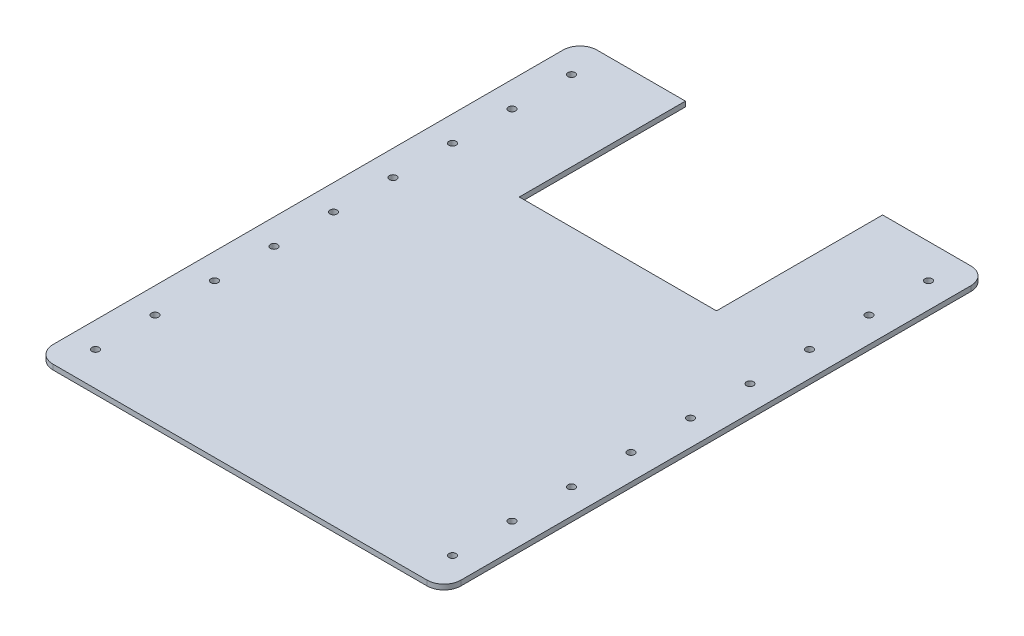
from build123d import *

# Parameters (mm, degrees)
SKETCH_1_W          = 240
SKETCH_1_H          = 320
EXTRUDE_1_DEPTH     = 3
FILLET_1_R          = 10
SKETCH_2_R          = 2.1
CUT_EXTRUDE_1_DEPTH = 3
SKETCH_3_W          = 115.999744718
SKETCH_3_H          = 97.711404684
CUT_EXTRUDE_2_DEPTH = 10


with BuildPart() as part:
    # 草图1 → 凸台-拉伸1 (new body)
    with BuildSketch(Plane(origin=(0, 0, 0), x_dir=(1, 0, 0), z_dir=(0, 1, 0))):
        Rectangle(SKETCH_1_W, SKETCH_1_H)
    extrude(amount=EXTRUDE_1_DEPTH)

    # 圆角1
    fillet_1_edges = [part.edges().sort_by_distance(p)[0] for p in [
        (-120, 1.5, -160),
        (120, 1.5, -160),
        (120, 1.5, 160),
        (-120, 1.5, 160),
    ]]
    fillet(fillet_1_edges, radius=FILLET_1_R)

    # 草图2 → 切除-拉伸1 (cut)
    with BuildSketch(Plane(origin=(0, 3, 0), x_dir=(1, 0, 0), z_dir=(0, 1, 0))):
        with Locations((-105, 140)):
            Circle(SKETCH_2_R)
        with Locations((-105, 105)):
            Circle(SKETCH_2_R)
        with Locations((-105, 70)):
            Circle(SKETCH_2_R)
        with Locations((-105, 35)):
            Circle(SKETCH_2_R)
        with Locations((-105, 0)):
            Circle(SKETCH_2_R)
        with Locations((-105, -35)):
            Circle(SKETCH_2_R)
        with Locations((-105, -70)):
            Circle(SKETCH_2_R)
        with Locations((-105, -105)):
            Circle(SKETCH_2_R)
        with Locations((-105, -140)):
            Circle(SKETCH_2_R)
        with Locations((105, -140)):
            Circle(SKETCH_2_R)
        with Locations((105, -105)):
            Circle(SKETCH_2_R)
        with Locations((105, -70)):
            Circle(SKETCH_2_R)
        with Locations((105, -35)):
            Circle(SKETCH_2_R)
        with Locations((105, 0)):
            Circle(SKETCH_2_R)
        with Locations((105, 35)):
            Circle(SKETCH_2_R)
        with Locations((105, 70)):
            Circle(SKETCH_2_R)
        with Locations((105, 105)):
            Circle(SKETCH_2_R)
        with Locations((105, 140)):
            Circle(SKETCH_2_R)
    extrude(amount=-CUT_EXTRUDE_1_DEPTH, mode=Mode.SUBTRACT)

    # 草图3 → 切除-拉伸2 (cut)
    with BuildSketch(Plane(origin=(0, 3, 0), x_dir=(1, 0, 0), z_dir=(0, 1, 0))):
        with Locations((0, 111.144297658)):
            Rectangle(SKETCH_3_W, SKETCH_3_H)
    extrude(amount=-CUT_EXTRUDE_2_DEPTH, mode=Mode.SUBTRACT)


solid = part.part
